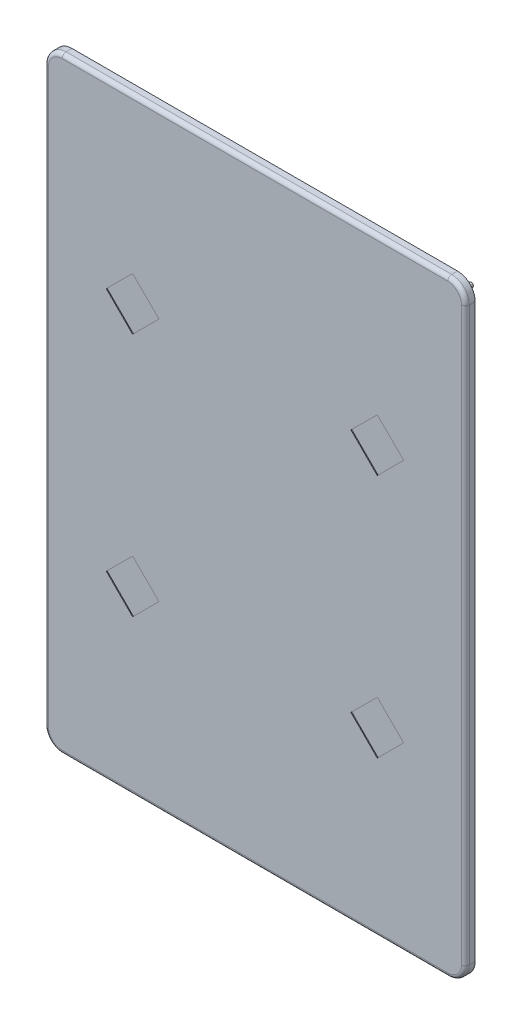
from build123d import *

# Parameters (mm, degrees)
SKETCH1_W           = 273.05
SKETCH1_H           = 393.7
BOSS_EXTRUDE1_DEPTH = 6.35
FILLET2_R           = 11.43
FILLET1_R           = 2.54
SKETCH2_R           = 1.397
BOSS_EXTRUDE2_DEPTH = 4.699
BOSS_EXTRUDE3_DEPTH = 6.35
CUT_EXTRUDE1_DEPTH  = 0.508


with BuildPart() as part:
    # Sketch1 → Boss-Extrude1 (new body)
    with BuildSketch(Plane.XY):
        with Locations((136.525, 196.85)):
            Rectangle(SKETCH1_W, SKETCH1_H)
    extrude(amount=BOSS_EXTRUDE1_DEPTH)

    # Fillet2
    fillet2_edges = [part.edges().sort_by_distance(p)[0] for p in [
        (0, 0, 3.175),
        (273.05, 0, 3.175),
        (0, 393.7, 3.175),
        (273.05, 393.7, 3.175),
    ]]
    fillet(fillet2_edges, radius=FILLET2_R)

    # Fillet1
    fillet1_edges = [part.edges().sort_by_distance(p)[0] for p in [
        (136.525, 393.7, 6.35),
        (273.05, 196.85, 6.35),
        (136.525, 0, 6.35),
        (0, 196.85, 6.35),
        (3.347769491, 390.352230509, 6.35),
        (269.702230509, 390.352230509, 6.35),
        (269.702230509, 3.347769491, 6.35),
        (3.347769491, 3.347769491, 6.35),
    ]]
    fillet(fillet1_edges, radius=FILLET1_R)

    # Sketch2 → Boss-Extrude2 (add)
    with BuildSketch(Plane(origin=(0, 0, 0), x_dir=(-1, 0, 0), z_dir=(0, 0, -1))):
        with Locations((-265.811, 385.826)):
            Circle(SKETCH2_R)
        with Locations((-136.525, 385.826)):
            Circle(SKETCH2_R)
        with Locations((-7.239, 385.826)):
            Circle(SKETCH2_R)
        with Locations((-136.525, 7.874)):
            Circle(SKETCH2_R)
        with Locations((-7.239, 7.874)):
            Circle(SKETCH2_R)
        with Locations((-265.811, 7.874)):
            Circle(SKETCH2_R)
    extrude(amount=BOSS_EXTRUDE2_DEPTH)

    # Sketch3 → Boss-Extrude3 (add)
    with BuildSketch(Plane(origin=(0, 9.779, 0), x_dir=(-1, 0, 0), z_dir=(0, -1, 0))):
        with BuildLine():
            Line((-240.03, 0), (-240.03, 0.254))
            Line((-240.03, 0.254), (-233.7435, 0.254))
            ThreePointArc((-233.7435, 0.254), (-233.204684633, 0.477184633), (-232.9815, 1.016))
            Line((-232.9815, 1.016), (-232.9815, 1.27))
            ThreePointArc((-232.9815, 1.27), (-230.9495, 3.302), (-228.9175, 1.27))
            Line((-228.9175, 1.27), (-228.9175, 1.016))
            ThreePointArc((-228.9175, 1.016), (-228.694315367, 0.477184633), (-228.1555, 0.254))
            Line((-228.1555, 0.254), (-221.869, 0.254))
            Line((-221.869, 0.254), (-221.869, 0))
            Line((-221.869, 0), (-240.03, 0))
        make_face()
    extrude(amount=-BOSS_EXTRUDE3_DEPTH)

    # Sketch4 → Cut-Extrude1 (cut)
    with BuildSketch(Plane.XY.offset(6.35)):
        Polygon((198.791738822, 276.225), (215.9, 293.241588949), (233.008261178, 276.225), (215.9, 259.116738822), align=None)
        Polygon((40.041738822, 276.225), (57.15, 293.241588949), (74.258261178, 276.225), (57.15, 259.116738822), align=None)
        Polygon((198.791738822, 117.475), (215.9, 134.491588949), (233.008261178, 117.475), (215.9, 100.366738822), align=None)
        Polygon((40.041738822, 117.475), (57.15, 134.491588949), (74.258261178, 117.475), (57.15, 100.366738822), align=None)
    extrude(amount=-CUT_EXTRUDE1_DEPTH, mode=Mode.SUBTRACT)


solid = part.part
